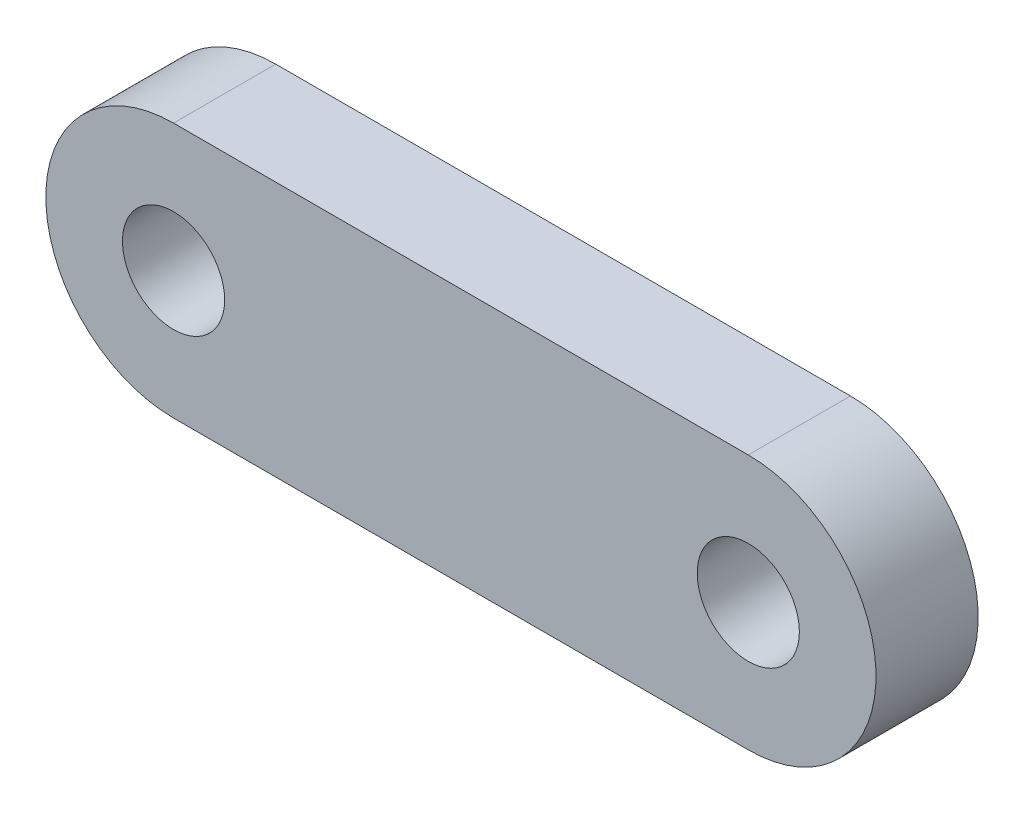
from build123d import *

# Parameters (mm, degrees)
SKETCH1_R           = 1.27
BOSS_EXTRUDE1_DEPTH = 2.54


with BuildPart() as part:
    # Sketch1 → Boss-Extrude1 (new body)
    with BuildSketch(Plane.XY):
        with BuildLine():
            Line((14.2875, 3.175), (0, 3.175))
            ThreePointArc((0, 3.175), (-3.175, 0), (0, -3.175))
            Line((0, -3.175), (14.2875, -3.175))
            ThreePointArc((14.2875, -3.175), (17.4625, 0), (14.2875, 3.175))
        make_face()
        with Locations((14.2875, 0)):
            Circle(SKETCH1_R, mode=Mode.SUBTRACT)
        Circle(SKETCH1_R, mode=Mode.SUBTRACT)
    extrude(amount=BOSS_EXTRUDE1_DEPTH)


solid = part.part
